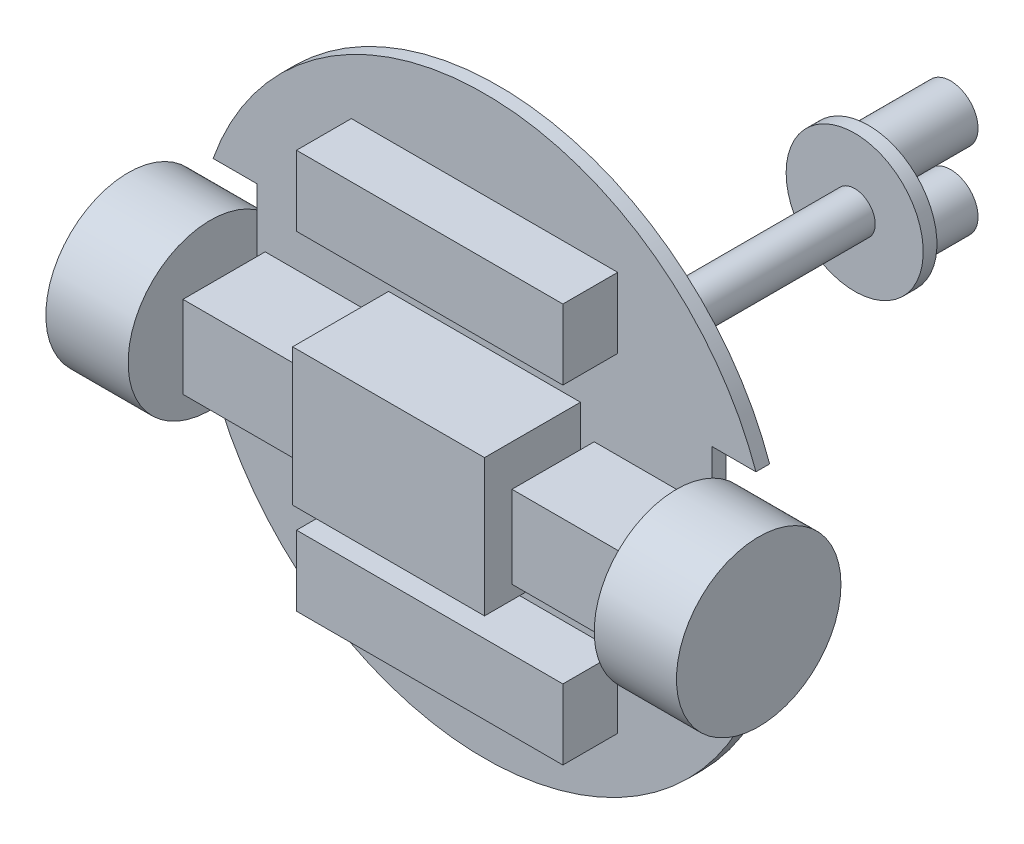
from build123d import *

# Parameters (mm, degrees)
BOSS_EXTRUDE1_DEPTH = 5
SKETCH2_W           = 70
SKETCH2_H           = 50
BOSS_EXTRUDE2_DEPTH = 35
SKETCH3_W           = 40
SKETCH3_H           = 30
BOSS_EXTRUDE3_DEPTH = 30
SKETCH4_R           = 5
BOSS_EXTRUDE4_DEPTH = 5
SKETCH5_R           = 30
BOSS_EXTRUDE5_DEPTH = 30
SKETCH6_R           = 7.5
BOSS_EXTRUDE6_DEPTH = 130
SKETCH7_R           = 25
BOSS_EXTRUDE7_DEPTH = 5
SKETCH9_R           = 10
BOSS_EXTRUDE8_DEPTH = 30
SKETCH10_W          = 97.144237238
SKETCH10_H          = 25.610753454
BOSS_EXTRUDE9_DEPTH = 20
SHELL1_START        = -105
SHELL1_OUTLINE_R    = 20
SHELL1_DEPTH        = 10
SHELL1_START_2      = 95
SHELL1_2_OUTLINE_R  = 20
SHELL1_2_DEPTH      = 10


# Read off the part's stored shape, not the designer's step: Shell1
with BuildPart() as part:
    # Sketch1 → Boss-Extrude1 (new body)
    with BuildSketch(Plane.XY):
        with BuildLine():
            Line((-98.994949366, 35), (-82.994949366, 35))
            Line((-82.994949366, 35), (-82.994949366, 0))
            Line((-82.994949366, 0), (-82.994949366, -35))
            Line((-82.994949366, -35), (-98.994949366, -35))
            ThreePointArc((-98.994949366, -35), (0, -105), (98.994949366, -35))
            Line((98.994949366, -35), (82.994949366, -35))
            Line((82.994949366, -35), (82.994949366, 0))
            Line((82.994949366, 0), (82.994949366, 35))
            Line((82.994949366, 35), (98.994949366, 35))
            ThreePointArc((98.994949366, 35), (0, 105), (-98.994949366, 35))
        make_face()
    extrude(amount=BOSS_EXTRUDE1_DEPTH)

    # Sketch2 → Boss-Extrude2 (add)
    with BuildSketch(Plane.XY.offset(5)):
        Rectangle(SKETCH2_W, SKETCH2_H)
    extrude(amount=BOSS_EXTRUDE2_DEPTH)

    # Sketch3 → Boss-Extrude3 (add)
    with BuildSketch(Plane.XY.offset(5)):
        with Locations((60, 0)):
            Rectangle(SKETCH3_W, SKETCH3_H)
    boss_extrude3 = extrude(amount=BOSS_EXTRUDE3_DEPTH)

    # Sketch4 → Boss-Extrude4 (add)
    with BuildSketch(Plane(origin=(80, 0, 0), x_dir=(0, 0, -1), z_dir=(1, 0, 0))):
        with Locations(Location((-20, 0, 0), (0, 0, 180))):
            Circle(SKETCH4_R)
    boss_extrude4 = extrude(amount=BOSS_EXTRUDE4_DEPTH)

    # Sketch5 → Boss-Extrude5 (add)
    with BuildSketch(Plane(origin=(85, 0, 0), x_dir=(0, 0, -1), z_dir=(1, 0, 0))):
        with Locations((-20, 0)):
            Circle(SKETCH5_R)
    boss_extrude5 = extrude(amount=BOSS_EXTRUDE5_DEPTH)

    # Mirror1: Boss-Extrude3, Boss-Extrude4, Boss-Extrude5 across plane
    add(boss_extrude3.mirror(Plane(origin=(0, 0, 0), x_dir=(0, 0, 1), z_dir=(1, 0, 0))))
    add(boss_extrude4.mirror(Plane(origin=(0, 0, 0), x_dir=(0, 0, 1), z_dir=(1, 0, 0))))
    add(boss_extrude5.mirror(Plane(origin=(0, 0, 0), x_dir=(0, 0, 1), z_dir=(1, 0, 0))))

    # Sketch6 → Boss-Extrude6 (add)
    with BuildSketch(Plane(origin=(0, 0, 0), x_dir=(-1, 0, 0), z_dir=(0, 0, -1))):
        with Locations(Location((0, 0, 0), (0, 0, 180))):
            Circle(SKETCH6_R)
    extrude(amount=BOSS_EXTRUDE6_DEPTH)

    # Sketch7 → Boss-Extrude7 (add)
    with BuildSketch(Plane(origin=(0, 0, -130), x_dir=(-1, 0, 0), z_dir=(0, 0, -1))):
        Circle(SKETCH7_R)
    extrude(amount=BOSS_EXTRUDE7_DEPTH)

    # Sketch9 → Boss-Extrude8 (add)
    with BuildSketch(Plane(origin=(0, 0, -135), x_dir=(-1, 0, 0), z_dir=(0, 0, -1))):
        with Locations((0, 14)):
            Circle(SKETCH9_R)
        with Locations((0, -14)):
            Circle(SKETCH9_R)
    extrude(amount=BOSS_EXTRUDE8_DEPTH)

    # Sketch10 → Boss-Extrude9 (add)
    with BuildSketch(Plane.XY.offset(5)):
        with Locations((0, 60)):
            Rectangle(SKETCH10_W, SKETCH10_H)
    boss_extrude9 = extrude(amount=BOSS_EXTRUDE9_DEPTH)

    # Mirror2: Boss-Extrude9 across plane
    add(boss_extrude9.mirror(Plane.ZX))

    # Shell1 outline → Shell1 (cut)
    with BuildSketch(Plane.YZ.offset(SHELL1_START)):
        with Locations((0, 20)):
            Circle(SHELL1_OUTLINE_R)
    extrude(amount=SHELL1_DEPTH, mode=Mode.SUBTRACT)

    # Shell1 2 outline → Shell1 2 (cut)
    with BuildSketch(Plane.YZ.offset(SHELL1_START_2)):
        with Locations((0, 20)):
            Circle(SHELL1_2_OUTLINE_R)
    extrude(amount=SHELL1_2_DEPTH, mode=Mode.SUBTRACT)


solid = part.part
